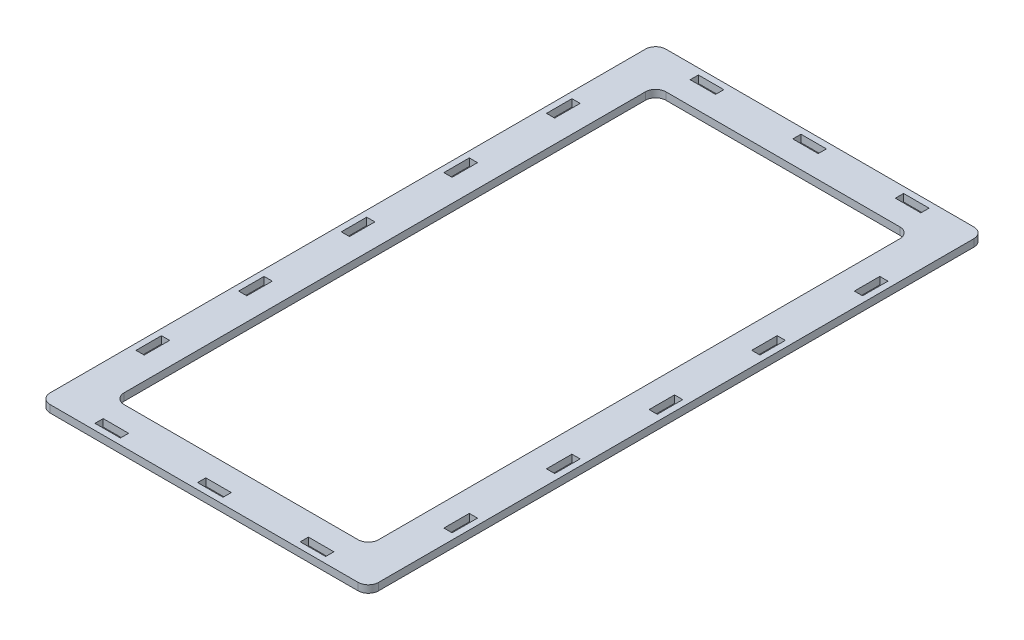
from build123d import *

# Parameters (mm, degrees)
SKETCH_1_W               = 800
SKETCH_1_H               = 1500
SKETCH_1_W_2             = 620
SKETCH_1_H_2             = 1320
EXTRUDE_1_DEPTH          = 18
SKETCH_1_5_W             = 20
SKETCH_1_5_H             = 62
CUT_EXTRUDE_1_DEPTH      = 851.190566873
PATTERN_LINEAR_1_COUNT   = 5
PATTERN_LINEAR_1_PITCH   = 250
MIRROR_1_COPY_1_SKETCH_W = 20
MIRROR_1_COPY_1_SKETCH_H = 62
MIRROR_1_COPY_1_DEPTH    = 851.190566873
MIRROR_1_COPY_2_SKETCH_W = 20
MIRROR_1_COPY_2_SKETCH_H = 62
MIRROR_1_COPY_2_DEPTH    = 851.190566873
MIRROR_1_COPY_3_SKETCH_W = 20
MIRROR_1_COPY_3_SKETCH_H = 62
MIRROR_1_COPY_3_DEPTH    = 851.190566873
MIRROR_1_COPY_4_SKETCH_W = 20
MIRROR_1_COPY_4_SKETCH_H = 62
MIRROR_1_COPY_4_DEPTH    = 851.190566873
SKETCH_1_4_W             = 62
SKETCH_1_4_H             = 20
CUT_EXTRUDE_2_DEPTH      = 851.190566873
PATTERN_LINEAR_2_COUNT   = 3
PATTERN_LINEAR_2_PITCH   = 250
MIRROR_2_COPY_1_SKETCH_W = 62
MIRROR_2_COPY_1_SKETCH_H = 20
MIRROR_2_COPY_1_DEPTH    = 851.190566873
MIRROR_2_COPY_2_SKETCH_W = 62
MIRROR_2_COPY_2_SKETCH_H = 20
MIRROR_2_COPY_2_DEPTH    = 851.190566873
FILLET_1_R               = 25
FILLET_2_R               = 25


with BuildPart() as part:
    # 草图1 → 凸台-拉伸1 (new body)
    with BuildSketch(Plane(origin=(0, 0, 0), x_dir=(1, 0, 0), z_dir=(0, 1, 0))):
        Rectangle(SKETCH_1_W, SKETCH_1_H)
        Rectangle(SKETCH_1_W_2, SKETCH_1_H_2, mode=Mode.SUBTRACT)
    extrude(amount=EXTRUDE_1_DEPTH)

    # 草图1<5> → 切除-拉伸1 (cut, through all)
    with BuildSketch(Plane(origin=(0, 0, 0), x_dir=(1, 0, 0), z_dir=(0, 1, 0))):
        with Locations((-375, -500)):
            Rectangle(SKETCH_1_5_W, SKETCH_1_5_H)
    cut_extrude_1 = extrude(amount=CUT_EXTRUDE_1_DEPTH, mode=Mode.SUBTRACT)

    # 阵列(线性)1: 切除-拉伸1 ×5
    with Locations(*[(0, 0, -i * PATTERN_LINEAR_1_PITCH) for i in range(1, PATTERN_LINEAR_1_COUNT)]):
        add(cut_extrude_1, mode=Mode.SUBTRACT)

    # 镜向1: 切除-拉伸1 across plane
    add(cut_extrude_1.mirror(Plane(origin=(0, 0, 0), x_dir=(0, 0, 1), z_dir=(1, 0, 0))), mode=Mode.SUBTRACT)

    # 镜向1 copy 1 sketch → 镜向1 copy 1 (cut, through all)
    with BuildSketch(Plane(origin=(0, 0, -250), x_dir=(-1, 0, 0), z_dir=(0, 1, 0))):
        with Locations((-375, 500)):
            Rectangle(MIRROR_1_COPY_1_SKETCH_W, MIRROR_1_COPY_1_SKETCH_H)
    extrude(amount=MIRROR_1_COPY_1_DEPTH, mode=Mode.SUBTRACT)

    # 镜向1 copy 2 sketch → 镜向1 copy 2 (cut, through all)
    with BuildSketch(Plane(origin=(0, 0, -500), x_dir=(-1, 0, 0), z_dir=(0, 1, 0))):
        with Locations((-375, 500)):
            Rectangle(MIRROR_1_COPY_2_SKETCH_W, MIRROR_1_COPY_2_SKETCH_H)
    extrude(amount=MIRROR_1_COPY_2_DEPTH, mode=Mode.SUBTRACT)

    # 镜向1 copy 3 sketch → 镜向1 copy 3 (cut, through all)
    with BuildSketch(Plane(origin=(0, 0, -750), x_dir=(-1, 0, 0), z_dir=(0, 1, 0))):
        with Locations((-375, 500)):
            Rectangle(MIRROR_1_COPY_3_SKETCH_W, MIRROR_1_COPY_3_SKETCH_H)
    extrude(amount=MIRROR_1_COPY_3_DEPTH, mode=Mode.SUBTRACT)

    # 镜向1 copy 4 sketch → 镜向1 copy 4 (cut, through all)
    with BuildSketch(Plane(origin=(0, 0, -1000), x_dir=(-1, 0, 0), z_dir=(0, 1, 0))):
        with Locations((-375, 500)):
            Rectangle(MIRROR_1_COPY_4_SKETCH_W, MIRROR_1_COPY_4_SKETCH_H)
    extrude(amount=MIRROR_1_COPY_4_DEPTH, mode=Mode.SUBTRACT)

    # 草图1<4> → 切除-拉伸2 (cut, through all)
    with BuildSketch(Plane(origin=(0, 0, 0), x_dir=(1, 0, 0), z_dir=(0, 1, 0))):
        with Locations((-250, -725)):
            Rectangle(SKETCH_1_4_W, SKETCH_1_4_H)
    cut_extrude_2 = extrude(amount=CUT_EXTRUDE_2_DEPTH, mode=Mode.SUBTRACT)

    # 阵列(线性)2: 切除-拉伸2 ×3
    with Locations(*[(i * PATTERN_LINEAR_2_PITCH, 0, 0) for i in range(1, PATTERN_LINEAR_2_COUNT)]):
        add(cut_extrude_2, mode=Mode.SUBTRACT)

    # 镜向2: 切除-拉伸2 across plane
    add(cut_extrude_2.mirror(Plane.XY), mode=Mode.SUBTRACT)

    # 镜向2 copy 1 sketch → 镜向2 copy 1 (cut, through all)
    with BuildSketch(Plane(origin=(250, 0, 0), x_dir=(1, 0, 0), z_dir=(0, 1, 0))):
        with Locations((-250, 725)):
            Rectangle(MIRROR_2_COPY_1_SKETCH_W, MIRROR_2_COPY_1_SKETCH_H)
    extrude(amount=MIRROR_2_COPY_1_DEPTH, mode=Mode.SUBTRACT)

    # 镜向2 copy 2 sketch → 镜向2 copy 2 (cut, through all)
    with BuildSketch(Plane(origin=(500, 0, 0), x_dir=(1, 0, 0), z_dir=(0, 1, 0))):
        with Locations((-250, 725)):
            Rectangle(MIRROR_2_COPY_2_SKETCH_W, MIRROR_2_COPY_2_SKETCH_H)
    extrude(amount=MIRROR_2_COPY_2_DEPTH, mode=Mode.SUBTRACT)

    # 圆角1
    fillet_1_edges = [part.edges().sort_by_distance(p)[0] for p in [
        (-400, 9, -750),
        (400, 9, -750),
        (400, 9, 750),
        (-400, 9, 750),
    ]]
    fillet(fillet_1_edges, radius=FILLET_1_R)

    # 圆角2
    fillet_2_edges = [part.edges().sort_by_distance(p)[0] for p in [
        (-310, 9, -660),
        (310, 9, -660),
        (310, 9, 660),
        (-310, 9, 660),
    ]]
    fillet(fillet_2_edges, radius=FILLET_2_R)


solid = part.part
